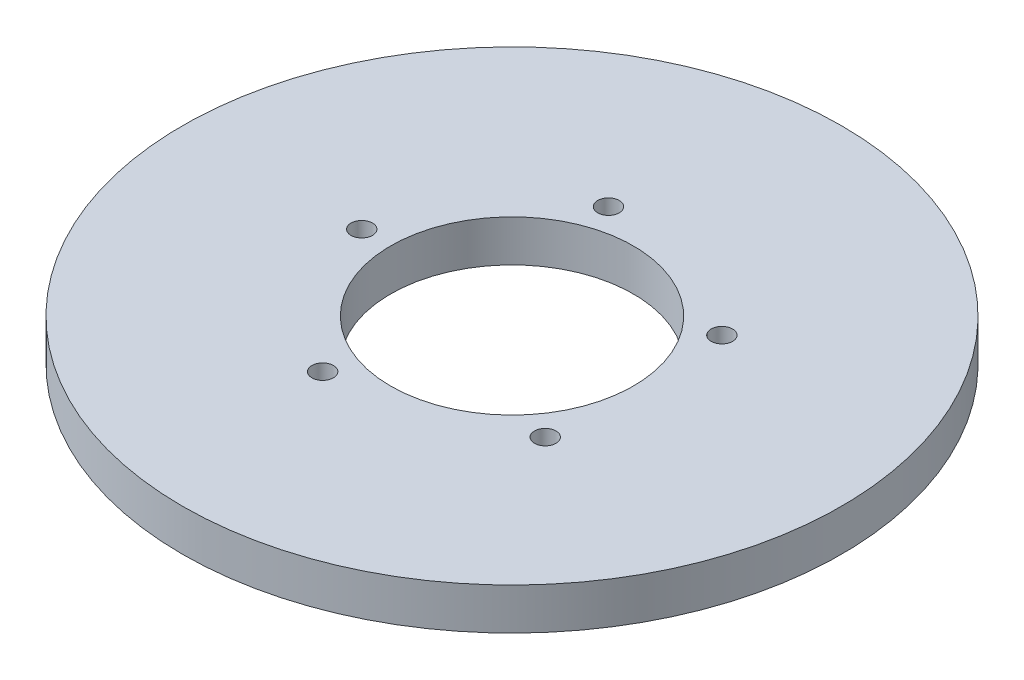
from build123d import *

# Parameters (mm, degrees)
SKETCH1_R           = 95
BOSS_EXTRUDE1_DEPTH = 12
SKETCH2_R           = 35
CUT_EXTRUDE1_DEPTH  = 135.88513632
SKETCH3_R           = 3.098023625
CUT_EXTRUDE2_DEPTH  = 11.771744529
CIRPATTERN1_COUNT   = 5


with BuildPart() as part:
    # Sketch1 → Boss-Extrude1 (new body)
    with BuildSketch(Plane(origin=(0, 0, 0), x_dir=(1, 0, 0), z_dir=(0, 1, 0))):
        Circle(SKETCH1_R)
    extrude(amount=BOSS_EXTRUDE1_DEPTH)

    # Sketch2 → Cut-Extrude1 (cut, through all)
    with BuildSketch(Plane(origin=(0, 0, 0), x_dir=(1, 0, 0), z_dir=(0, 1, 0))):
        Circle(SKETCH2_R)
    extrude(amount=CUT_EXTRUDE1_DEPTH, mode=Mode.SUBTRACT)

    # Sketch3 → Cut-Extrude2 (cut)
    with BuildSketch(Plane(origin=(0, 12, 0), x_dir=(1, 0, 0), z_dir=(0, 1, 0))):
        with Locations((-43.313134438, 0)):
            Circle(SKETCH3_R)
    cut_extrude2 = extrude(amount=-CUT_EXTRUDE2_DEPTH, mode=Mode.SUBTRACT)

    # CirPattern1: Cut-Extrude2 ×5 about axis
    cirpattern1_axis = Axis((0, 0, 0), (0, 1, 0))
    for i in range(1, CIRPATTERN1_COUNT):
        add(cut_extrude2.rotate(cirpattern1_axis, i * 360 / CIRPATTERN1_COUNT), mode=Mode.SUBTRACT)


solid = part.part
